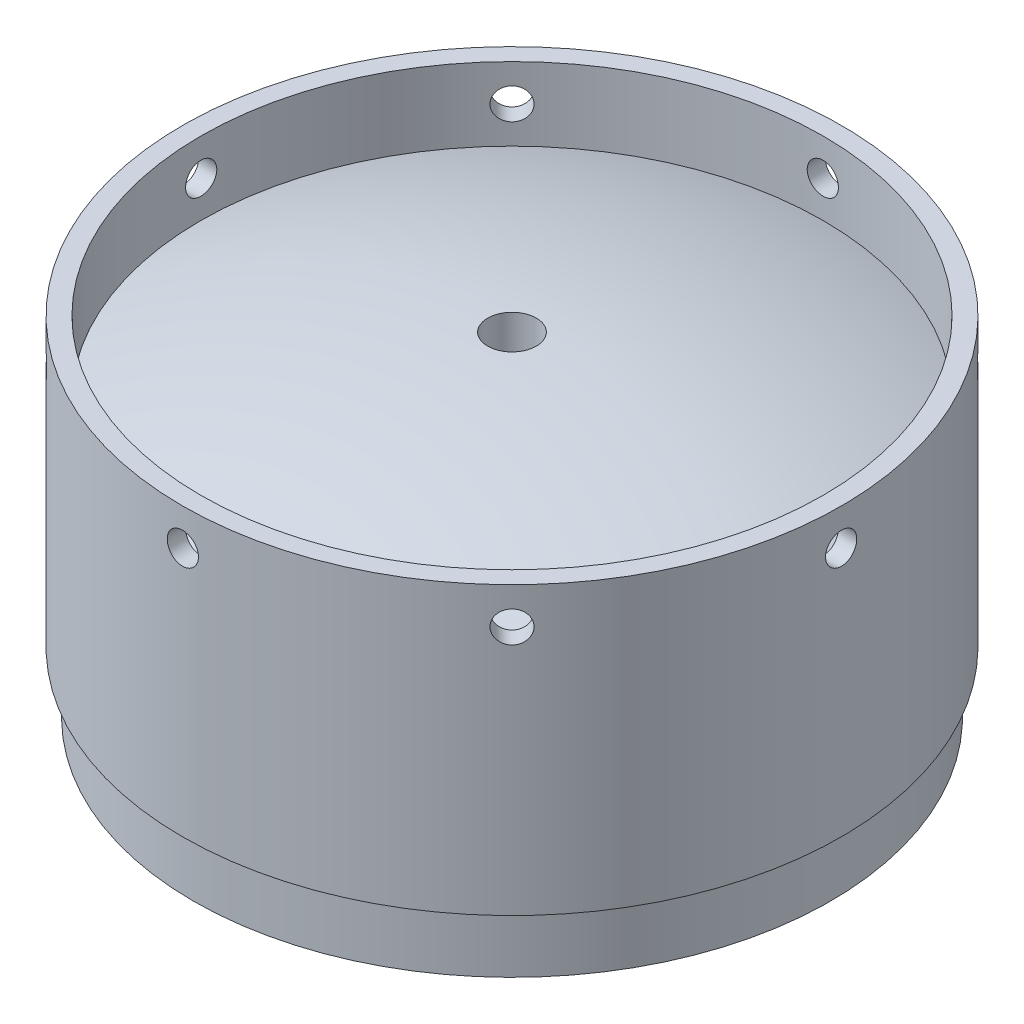
from build123d import *

# Parameters (mm, degrees)
CIRPATTERN1_COUNT = 8


with BuildPart() as part:
    # Sketch1 → Revolve2 (revolve)
    with BuildSketch(Plane.XY):
        with BuildLine():
            Line((-57.15, 60.325), (-57.15, 10.624852263))
            Line((-57.15, 10.624852263), (-55.245, 9.525))
            Line((-55.245, 9.525), (-55.245, 0))
            Line((-55.245, 0), (-53.975, 0))
            Line((-53.975, 0), (-53.975, 9.525))
            Line((-53.975, 9.525), (-50.781921876, 27.633845912))
            ThreePointArc((-50.781921876, 27.633845912), (-46.870428751, 39.197932975), (-36.74222533, 46.013164706))
            ThreePointArc((-36.74222533, 46.013164706), (-20.622663236, 49.400939387), (-4.2164, 50.86784975))
            Line((-4.2164, 50.86784975), (-4.2164, 57.855881692))
            ThreePointArc((-4.2164, 57.855881692), (-29.541961572, 54.910864836), (-53.975, 47.625))
            Line((-53.975, 47.625), (-53.975, 60.325))
            Line((-53.975, 60.325), (-57.15, 60.325))
        make_face()
    revolve(axis=Axis((0, 127.060987048, 0), (0, -1, 0)))

    # Sketch5 → #3 (0.213) Diameter Hole1 (revolve, cut)
    with BuildSketch(Plane(origin=(0, 53.975, 57.15), x_dir=(0, -1, 0), z_dir=(1, 0, 0))):
        Polygon((0, 0), (0, 13.309388061), (2.7051, 11.684), (2.7051, 0), align=None)
    f_3_0_213_diameter_hole1 = revolve(axis=Axis((0, 53.975, 63.5), (0, 0, -1)), mode=Mode.SUBTRACT)

    # CirPattern1: #3 (0.213) Diameter Hole1 ×8 about axis
    cirpattern1_axis = Axis((0, 127.060987048, 0), (0, -1, 0))
    for i in range(1, CIRPATTERN1_COUNT):
        add(f_3_0_213_diameter_hole1.rotate(cirpattern1_axis, i * 360 / CIRPATTERN1_COUNT), mode=Mode.SUBTRACT)


solid = part.part
